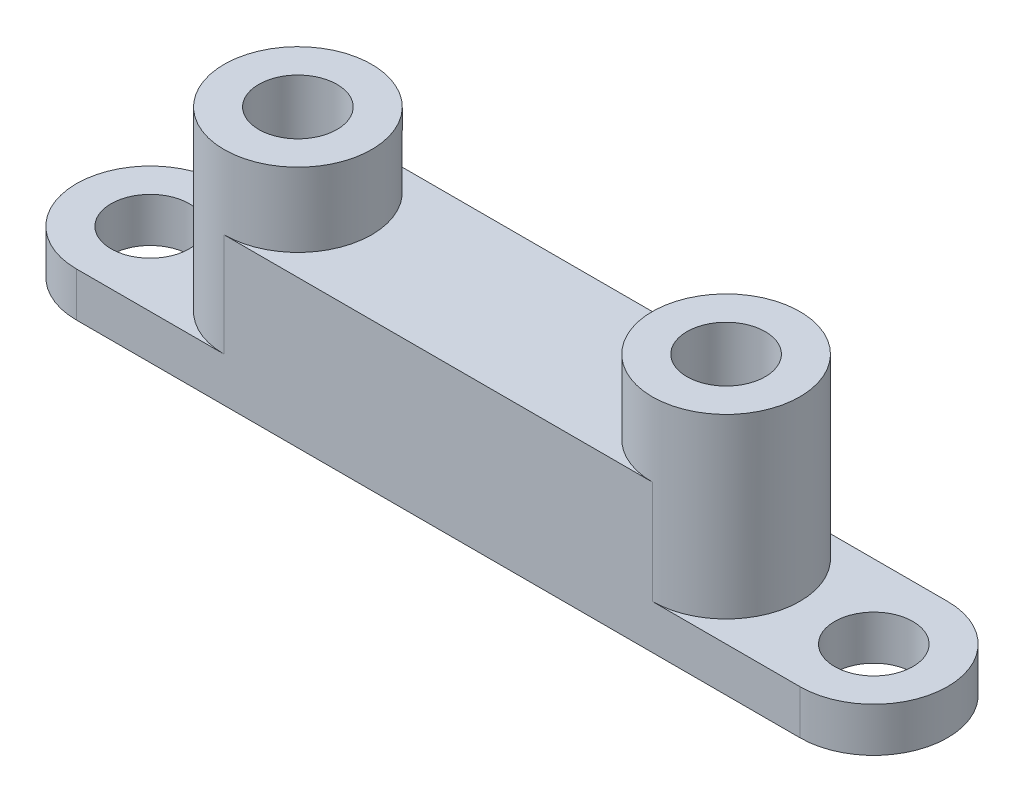
from build123d import *

# Parameters (mm, degrees)
ESQUISSE1_R             = 2.65
BOSS_EXTRU_1_DEPTH      = 15
ESQUISSE2_R             = 3.488871883
ESQUISSE2_R_2           = 3.573781448
BOSS_EXTRU_2_DEPTH      = 4
ENL_V_START             = -5
ENL_V_MAT_EXTRU_1_DEPTH = 5
ESQUISSE8_R             = 2.65
BOSS_EXTRU_3_DEPTH      = 3


with BuildPart() as part:
    # Esquisse1 → Boss.-Extru.1 (new body)
    with BuildSketch(Plane(origin=(0, 0, 0), x_dir=(1, 0, 0), z_dir=(0, 1, 0))):
        with BuildLine():
            Line((5, 0), (34, 0))
            ThreePointArc((34, 0), (39, 5), (34, 10))
            Line((34, 10), (5, 10))
            ThreePointArc((5, 10), (0, 5), (5, 0))
        make_face()
        with Locations((5, 5)):
            Circle(ESQUISSE1_R, mode=Mode.SUBTRACT)
        with Locations((34, 5)):
            Circle(ESQUISSE1_R, mode=Mode.SUBTRACT)
    extrude(amount=BOSS_EXTRU_1_DEPTH)

    # Esquisse2 → Boss.-Extru.2 (add)
    with BuildSketch(Plane.XZ):
        with Locations((5, -5)):
            Circle(ESQUISSE2_R)
        with Locations((34, -5)):
            Circle(ESQUISSE2_R_2)
    extrude(amount=-BOSS_EXTRU_2_DEPTH)

    # Esquisse3 → Enlèv. mat.-Extru.1 (cut)
    with BuildSketch(Plane(origin=(0, 15, 0), x_dir=(1, 0, 0), z_dir=(0, 1, 0)).offset(ENL_V_START)):
        with BuildLine():
            Line((5, 10), (34, 10))
            ThreePointArc((34, 10), (29, 5), (34, 0))
            Line((34, 0), (5, 0))
            ThreePointArc((5, 0), (10, 5), (5, 10))
        make_face()
    extrude(amount=ENL_V_MAT_EXTRU_1_DEPTH, mode=Mode.SUBTRACT)

    # Esquisse8 → Boss.-Extru.3 (add)
    with BuildSketch(Plane.XZ):
        with BuildLine():
            Line((44.001861421, -10), (-5.001861421, -10))
            ThreePointArc((-5.001861421, -10), (-10.001861421, -5), (-5.001861421, 0))
            Line((-5.001861421, 0), (44.001861421, 0))
            ThreePointArc((44.001861421, 0), (49.001861421, -5), (44.001861421, -10))
        make_face()
        with Locations((-5.001861421, -5)):
            Circle(ESQUISSE8_R, mode=Mode.SUBTRACT)
        with Locations((44.001861421, -5)):
            Circle(ESQUISSE8_R, mode=Mode.SUBTRACT)
    extrude(amount=-BOSS_EXTRU_3_DEPTH)


solid = part.part
